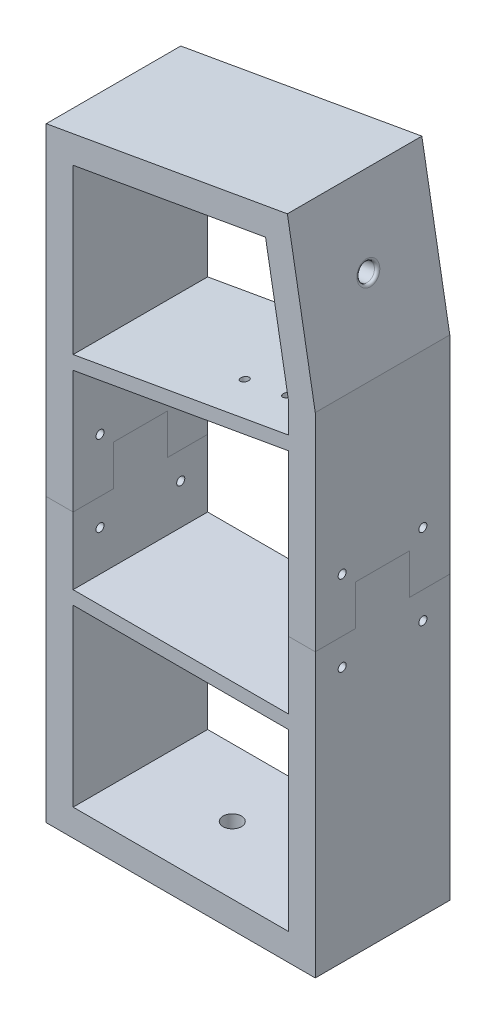
from build123d import *

# Parameters (mm, degrees)
BOSS_EXTRUDE1_DEPTH    = 50
SKETCH4_R              = 3.2
CUT_EXTRUDE1_DEPTH     = 10
BOSS_EXTRUDE2_DEPTH    = 50
SKETCH8_R              = 5
CUT_EXTRUDE3_DEPTH     = 10
CUT_EXTRUDE4_REACH     = 260.512
SKETCH9_R              = 1.485
SKETCH10_R             = 3.425
CUT_EXTRUDE5_DEPTH     = 10
SKETCH11_W             = 80
SKETCH11_H             = 5
BOSS_EXTRUDE3_DEPTH    = 50
FILLET1_R              = 1
SKETCH13_R             = 1.5
CUT_EXTRUDE6_DEPTH     = 266.502494397
SPLIT1_SURFACE_1_BACK  = 266.502
SPLIT1_SURFACE_1_DEPTH = 533.004
SPLIT1_SURFACE_2_BACK  = 266.502
SPLIT1_SURFACE_2_DEPTH = 533.004


with BuildPart() as part:
    # Sketch2 → Boss-Extrude1 (new body)
    with BuildSketch(Plane.XY):
        Polygon((-50, 225.01), (-50, 0), (50, 0), (50, 182.01), (39.631197958, 240.814398513), align=None)
        Polygon((-40, 216.619003688), (-40, 10), (40, 10), (40, 181.135113365), (31.519602204, 229.229839206), align=None, mode=Mode.SUBTRACT)
    extrude(amount=BOSS_EXTRUDE1_DEPTH)

    # Sketch4 → Cut-Extrude1 (cut)
    with BuildSketch(Plane(origin=(79.617858663, 14.038776629, 0), x_dir=(0, 0, -1), z_dir=(0.9848077530122079, 0.17364817766693136, 0))):
        with Locations((-25, 200.891001389)):
            Circle(SKETCH4_R)
    extrude(amount=-CUT_EXTRUDE1_DEPTH, mode=Mode.SUBTRACT)

    # Sketch7 → Boss-Extrude2 (add)
    with BuildSketch(Plane.XY.offset(50)):
        Polygon((40, 169.799565432), (40, 164.722432372), (-40, 150.616273916), (-40, 155.693406975), align=None)
    extrude(amount=-BOSS_EXTRUDE2_DEPTH)

    # Sketch8 → Cut-Extrude3 (cut)
    with BuildSketch(Plane.ZY.offset(50)):
        with Locations((25, 204.163858422)):
            Circle(SKETCH8_R)
    extrude(amount=-CUT_EXTRUDE3_DEPTH, mode=Mode.SUBTRACT)

    # Sketch9 → Cut-Extrude4 (cut, up to next)
    with BuildSketch(Plane(origin=(128.377379322, 180.305748831, 0), x_dir=(-0.9848077530122079, -0.17364817766693152, 0), z_dir=(-0.17364817766693152, 0.9848077530122079, 0)), mode=Mode.PRIVATE) as cut_extrude4_sk1:
        with Locations((104.969193438, 15.4)):
            Circle(SKETCH9_R)
    cut_extrude4_tool1 = extrude(cut_extrude4_sk1.sketch, amount=CUT_EXTRUDE4_REACH, mode=Mode.PRIVATE) & part.part
    # Sketch9 → Cut-Extrude4 (cut, up to next)
    with BuildSketch(Plane(origin=(128.377379322, 180.305748831, 0), x_dir=(-0.9848077530122079, -0.17364817766693152, 0), z_dir=(-0.17364817766693152, 0.9848077530122079, 0)), mode=Mode.PRIVATE) as cut_extrude4_sk2:
        with Locations((104.969193438, 34.6)):
            Circle(SKETCH9_R)
    cut_extrude4_tool2 = extrude(cut_extrude4_sk2.sketch, amount=CUT_EXTRUDE4_REACH, mode=Mode.PRIVATE) & part.part
    # Sketch9 → Cut-Extrude4 (cut, up to next)
    with BuildSketch(Plane(origin=(128.377379322, 180.305748831, 0), x_dir=(-0.9848077530122079, -0.17364817766693152, 0), z_dir=(-0.17364817766693152, 0.9848077530122079, 0)), mode=Mode.PRIVATE) as cut_extrude4_sk3:
        with Locations((120.969193438, 34.6)):
            Circle(SKETCH9_R)
    cut_extrude4_tool3 = extrude(cut_extrude4_sk3.sketch, amount=CUT_EXTRUDE4_REACH, mode=Mode.PRIVATE) & part.part
    # Sketch9 → Cut-Extrude4 (cut, up to next)
    with BuildSketch(Plane(origin=(128.377379322, 180.305748831, 0), x_dir=(-0.9848077530122079, -0.17364817766693152, 0), z_dir=(-0.17364817766693152, 0.9848077530122079, 0)), mode=Mode.PRIVATE) as cut_extrude4_sk4:
        with Locations((120.969193438, 15.4)):
            Circle(SKETCH9_R)
    cut_extrude4_tool4 = extrude(cut_extrude4_sk4.sketch, amount=CUT_EXTRUDE4_REACH, mode=Mode.PRIVATE) & part.part
    add(cut_extrude4_tool1.solids().sort_by_distance((25.002904, 162.07804, 15.4))[0], mode=Mode.SUBTRACT)
    add(cut_extrude4_tool2.solids().sort_by_distance((25.002904, 162.07804, 34.6))[0], mode=Mode.SUBTRACT)
    add(cut_extrude4_tool3.solids().sort_by_distance((9.24598, 159.299669, 34.6))[0], mode=Mode.SUBTRACT)
    add(cut_extrude4_tool4.solids().sort_by_distance((9.24598, 159.299669, 15.4))[0], mode=Mode.SUBTRACT)

    # Sketch10 → Cut-Extrude5 (cut)
    with BuildSketch(Plane(origin=(0, 10, 0), x_dir=(1, 0, 0), z_dir=(0, 1, 0))):
        with Locations((-5.851287133, -25)):
            Circle(SKETCH10_R)
        with Locations((24.130974018, -25)):
            Circle(SKETCH10_R)
    extrude(amount=-CUT_EXTRUDE5_DEPTH, mode=Mode.SUBTRACT)

    # Sketch11 → Boss-Extrude3 (add)
    with BuildSketch(Plane.XY.offset(50)):
        with Locations((0, 77.5)):
            Rectangle(SKETCH11_W, SKETCH11_H)
    extrude(amount=-BOSS_EXTRUDE3_DEPTH)

    # Fillet1
    fillet1_edges = [part.edges().sort_by_distance(p)[0] for p in [
        (44.733502362, 211.877792306, 28.2),
    ]]
    fillet(fillet1_edges, radius=FILLET1_R)

    # Sketch13 → Cut-Extrude6 (cut, through all)
    with BuildSketch(Plane.ZY.offset(50)):
        with Locations((40, 125)):
            Circle(SKETCH13_R)
        with Locations((40, 95)):
            Circle(SKETCH13_R)
        with Locations((10, 95)):
            Circle(SKETCH13_R)
        with Locations((10, 125)):
            Circle(SKETCH13_R)
    extrude(amount=-CUT_EXTRUDE6_DEPTH, mode=Mode.SUBTRACT)


with BuildPart() as body_2:
    # Split1: the piece behind the surface
    add(part.part)
    # Split1 surface: a surface, the sketch's curves swept straight by 533.004 mm
    with BuildLine(Plane.ZY.offset(50).offset(-SPLIT1_SURFACE_1_BACK), mode=Mode.PRIVATE) as split1_surface_1_path:
        Line((50, 105), (35, 105))
        Line((35, 105), (35, 120))
        Line((35, 120), (15, 120))
        Line((15, 120), (15, 105))
        Line((15, 105), (0, 105))
    split1_surface_1 = Shell.extrude(split1_surface_1_path.wire(), (-1 * SPLIT1_SURFACE_1_DEPTH, 0 * SPLIT1_SURFACE_1_DEPTH, 0 * SPLIT1_SURFACE_1_DEPTH))
    split(bisect_by=split1_surface_1, keep=Keep.BOTTOM)


with BuildPart() as part_1:
    add(part.part)

    # Split1: split by a surface, the side it looks to stays
    # Split1 surface: a surface, the sketch's curves swept straight by 533.004 mm
    with BuildLine(Plane.ZY.offset(50).offset(-SPLIT1_SURFACE_2_BACK), mode=Mode.PRIVATE) as split1_surface_2_path:
        Line((50, 105), (35, 105))
        Line((35, 105), (35, 120))
        Line((35, 120), (15, 120))
        Line((15, 120), (15, 105))
        Line((15, 105), (0, 105))
    split1_surface_2 = Shell.extrude(split1_surface_2_path.wire(), (-1 * SPLIT1_SURFACE_2_DEPTH, 0 * SPLIT1_SURFACE_2_DEPTH, 0 * SPLIT1_SURFACE_2_DEPTH))
    split(bisect_by=split1_surface_2, keep=Keep.TOP)


solid = Compound([body_2.part, part_1.part])
